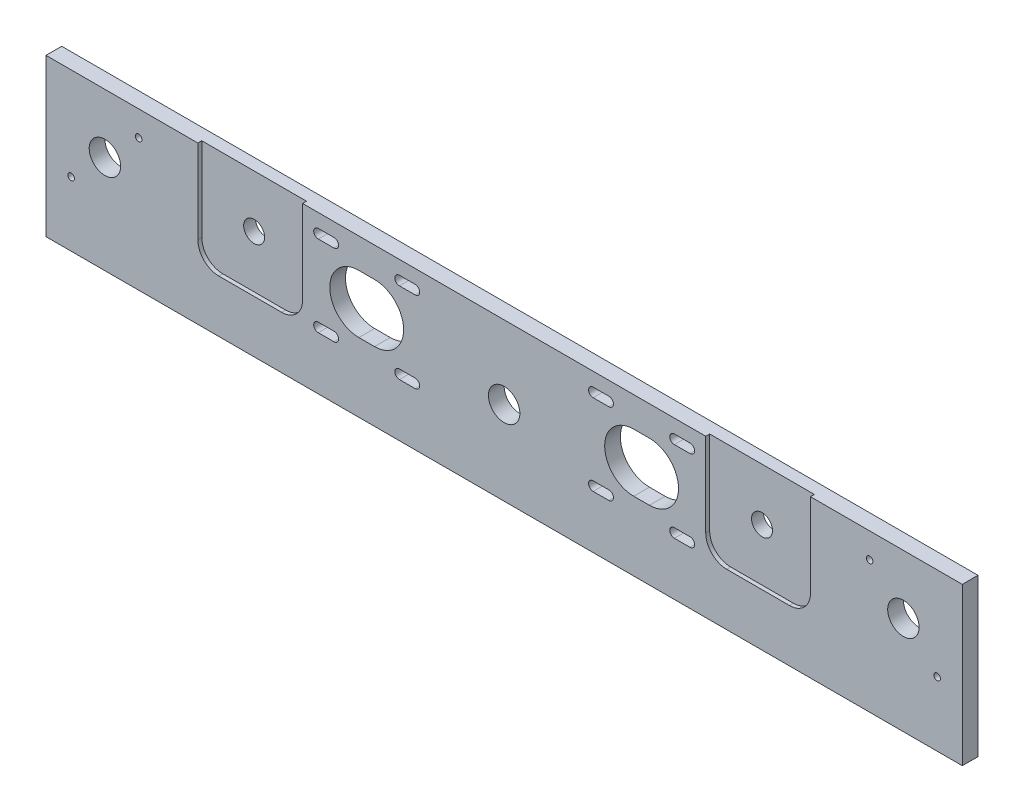
from build123d import *

# Parameters (mm, degrees)
CROQUIS1_W              = 350
CROQUIS1_H              = 60
SALIENTE_EXTRUIR1_DEPTH = 6
CROQUIS2_R              = 6
CROQUIS2_R_2            = 1.25
CORTAR_EXTRUIR1_DEPTH   = 356.156303619
CROQUIS3_R              = 6
CORTAR_EXTRUIR2_DEPTH   = 356.156303619
CORTAR_EXTRUIR4_DEPTH   = 1.5
CROQUIS7_R              = 4
CORTAR_EXTRUIR5_DEPTH   = 356.13412959


with BuildPart() as part:
    # Croquis1 → Saliente-Extruir1 (new body)
    with BuildSketch(Plane.XY):
        with Locations((-175, -30)):
            Rectangle(CROQUIS1_W, CROQUIS1_H)
    extrude(amount=SALIENTE_EXTRUIR1_DEPTH)

    # Croquis2 → Cortar-Extruir1 (cut, through all)
    with BuildSketch(Plane.XY.offset(6)):
        with Locations((-327.5, -22.5)):
            Circle(CROQUIS2_R)
        with Locations((-22.5, -22.5)):
            Circle(CROQUIS2_R)
        with Locations((-314.595301243, -9.595301243)):
            Circle(CROQUIS2_R_2)
        with Locations((-340.404698757, -35.404698757)):
            Circle(CROQUIS2_R_2)
        with Locations((-35.404698757, -9.595301243)):
            Circle(CROQUIS2_R_2)
        with Locations((-9.595301243, -35.404698757)):
            Circle(CROQUIS2_R_2)
    extrude(amount=-CORTAR_EXTRUIR1_DEPTH, mode=Mode.SUBTRACT)

    # Croquis3 → Cortar-Extruir2 (cut, through all)
    with BuildSketch(Plane.XY.offset(6)):
        with Locations((-175, -28)):
            Circle(CROQUIS3_R)
        with BuildLine():
            Line((-141, -5.25), (-135, -5.25))
            ThreePointArc((-135, -5.25), (-133.25, -7), (-135, -8.75))
            Line((-135, -8.75), (-141, -8.75))
            ThreePointArc((-141, -8.75), (-142.75, -7), (-141, -5.25))
        make_face()
        with BuildLine():
            Line((-125.5, -11.4), (-119.5, -11.4))
            ThreePointArc((-119.5, -11.4), (-108.4, -22.5), (-119.5, -33.6))
            Line((-119.5, -33.6), (-125.5, -33.6))
            ThreePointArc((-125.5, -33.6), (-136.6, -22.5), (-125.5, -11.4))
        make_face()
        with BuildLine():
            Line((-141, -36.25), (-135, -36.25))
            ThreePointArc((-135, -36.25), (-133.25, -38), (-135, -39.75))
            Line((-135, -39.75), (-141, -39.75))
            ThreePointArc((-141, -39.75), (-142.75, -38), (-141, -36.25))
        make_face()
        with BuildLine():
            Line((-110, -5.25), (-104, -5.25))
            ThreePointArc((-104, -5.25), (-102.25, -7), (-104, -8.75))
            Line((-104, -8.75), (-110, -8.75))
            ThreePointArc((-110, -8.75), (-111.75, -7), (-110, -5.25))
        make_face()
        with BuildLine():
            Line((-110, -36.25), (-104, -36.25))
            ThreePointArc((-104, -36.25), (-102.25, -38), (-104, -39.75))
            Line((-104, -39.75), (-110, -39.75))
            ThreePointArc((-110, -39.75), (-111.75, -38), (-110, -36.25))
        make_face()
        with BuildLine():
            Line((-246, -5.25), (-240, -5.25))
            ThreePointArc((-240, -5.25), (-238.25, -7), (-240, -8.75))
            Line((-240, -8.75), (-246, -8.75))
            ThreePointArc((-246, -8.75), (-247.75, -7), (-246, -5.25))
        make_face()
        with BuildLine():
            Line((-230.5, -11.4), (-224.5, -11.4))
            ThreePointArc((-224.5, -11.4), (-213.4, -22.5), (-224.5, -33.6))
            Line((-224.5, -33.6), (-230.5, -33.6))
            ThreePointArc((-230.5, -33.6), (-241.6, -22.5), (-230.5, -11.4))
        make_face()
        with BuildLine():
            Line((-246, -36.25), (-240, -36.25))
            ThreePointArc((-240, -36.25), (-238.25, -38), (-240, -39.75))
            Line((-240, -39.75), (-246, -39.75))
            ThreePointArc((-246, -39.75), (-247.75, -38), (-246, -36.25))
        make_face()
        with BuildLine():
            Line((-215, -5.25), (-209, -5.25))
            ThreePointArc((-209, -5.25), (-207.25, -7), (-209, -8.75))
            Line((-209, -8.75), (-215, -8.75))
            ThreePointArc((-215, -8.75), (-216.75, -7), (-215, -5.25))
        make_face()
        with BuildLine():
            Line((-215, -36.25), (-209, -36.25))
            ThreePointArc((-209, -36.25), (-207.25, -38), (-209, -39.75))
            Line((-209, -39.75), (-215, -39.75))
            ThreePointArc((-215, -39.75), (-216.75, -38), (-215, -36.25))
        make_face()
    extrude(amount=-CORTAR_EXTRUIR2_DEPTH, mode=Mode.SUBTRACT)

    # Croquis5 → Cortar-Extruir4 (cut)
    with BuildSketch(Plane.XY.offset(6)):
        with BuildLine():
            Line((-292, 0), (-252, 0))
            Line((-252, 0), (-252, -32))
            ThreePointArc((-252, -32), (-254.343145751, -37.656854249), (-260, -40))
            Line((-260, -40), (-284, -40))
            ThreePointArc((-284, -40), (-289.656854249, -37.656854249), (-292, -32))
            Line((-292, -32), (-292, 0))
        make_face()
        with BuildLine():
            Line((-98, 0), (-58, 0))
            Line((-58, 0), (-58, -32))
            ThreePointArc((-58, -32), (-60.343145751, -37.656854249), (-66, -40))
            Line((-66, -40), (-90, -40))
            ThreePointArc((-90, -40), (-95.656854249, -37.656854249), (-98, -32))
            Line((-98, -32), (-98, 0))
        make_face()
    extrude(amount=-CORTAR_EXTRUIR4_DEPTH, mode=Mode.SUBTRACT)

    # Croquis7 → Cortar-Extruir5 (cut, through all)
    with BuildSketch(Plane.XY.offset(4.5)):
        with Locations((-272, -20)):
            Circle(CROQUIS7_R)
        with Locations((-78, -20)):
            Circle(CROQUIS7_R)
    extrude(amount=-CORTAR_EXTRUIR5_DEPTH, mode=Mode.SUBTRACT)


solid = part.part
